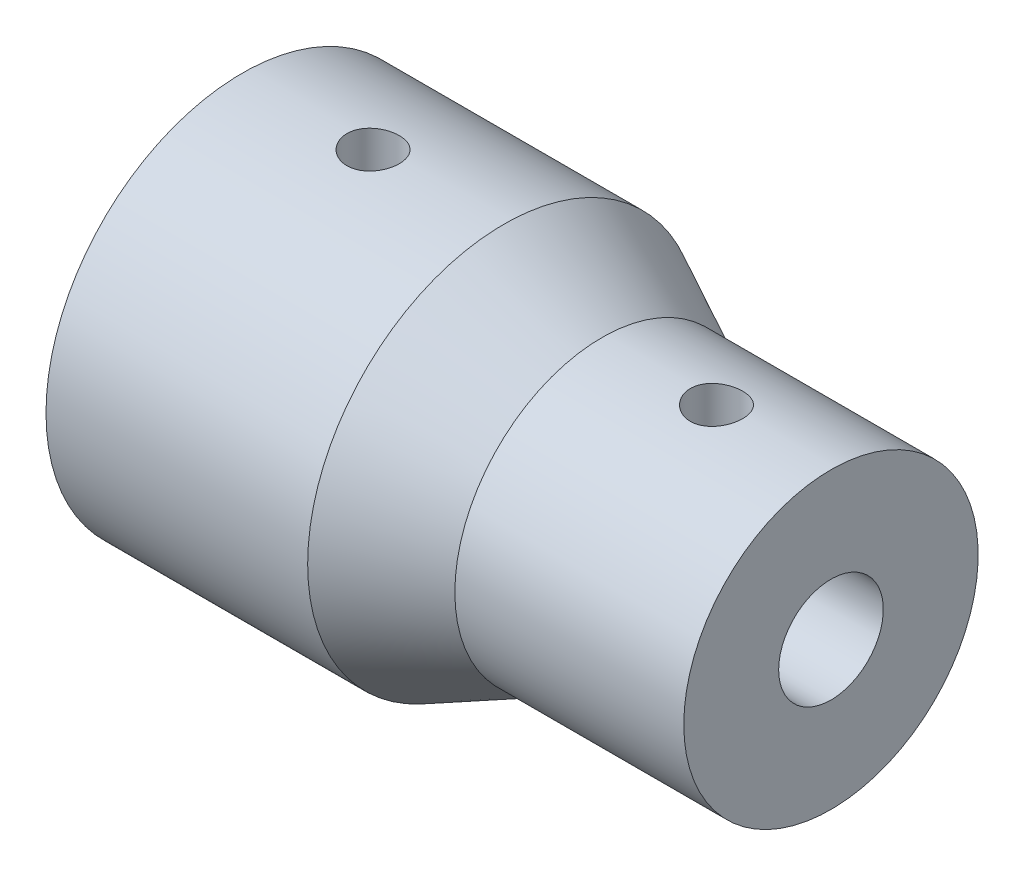
from build123d import *

# Parameters (mm, degrees)
SKETCH2_R          = 1.016
CUT_EXTRUDE1_DEPTH = 17.655893852
CIRPATTERN1_COUNT  = 2
CIRPATTERN1_ANGLE  = 90


with BuildPart() as part:
    # Sketch1 → Revolve1 (revolve)
    with BuildSketch(Plane(origin=(0, 0, 0), x_dir=(1, 0, 0), z_dir=(0, 1, 0))):
        Polygon((-10.16, 3.3655), (0, 3.3655), (2.54, 2.032), (12.7, 2.032), (12.7, 5.715), (3.81, 5.715), (0, 7.62), (-10.16, 7.62), align=None)
    revolve(axis=Axis((0, 0, 0), (1, 0, 0)))

    # Sketch2 → Cut-Extrude1 (cut, through all)
    with BuildSketch(Plane(origin=(0, 0, 0), x_dir=(1, 0, 0), z_dir=(0, 1, 0))):
        with Locations((-5.08, 0)):
            Circle(SKETCH2_R)
        with Locations((8.255, 0)):
            Circle(SKETCH2_R)
    cut_extrude1 = extrude(amount=CUT_EXTRUDE1_DEPTH, mode=Mode.SUBTRACT)

    # CirPattern1: Cut-Extrude1 ×2 about axis
    cirpattern1_axis = Axis((-10.16, 0, 0), (-1, 0, 0))
    for i in range(1, CIRPATTERN1_COUNT):
        add(cut_extrude1.rotate(cirpattern1_axis, i * CIRPATTERN1_ANGLE / (CIRPATTERN1_COUNT - 1)), mode=Mode.SUBTRACT)


solid = part.part
